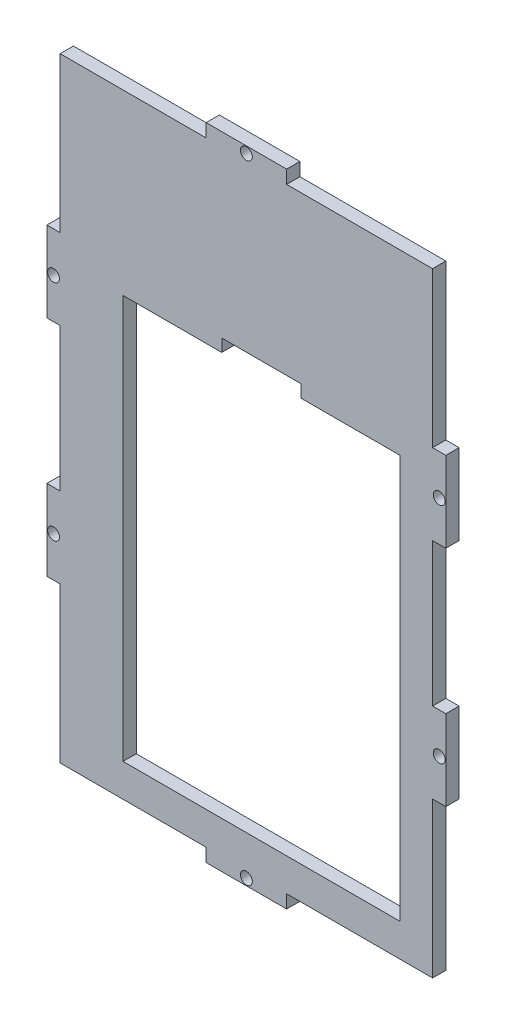
from build123d import *

# Parameters (mm, degrees)
BOSS_EXTRUDE1_DEPTH     = 3.18
CUT_EXTRUDE1_DEPTH      = 87.179315674
SKETCH27_W              = 3.18
SKETCH27_H              = 19.3
BOSS_EXTRUDE9_DEPTH     = 3.18
SKETCH28_W              = 19.3
SKETCH28_H              = 3.18
BOSS_EXTRUDE10_DEPTH    = 3.18
SKETCH29_R              = 1.425
CUT_EXTRUDE14_DEPTH     = 91.550668965
SKETCH30_R              = 1.425
CUT_EXTRUDE15_DEPTH     = 91.550668965
MIRROR9_COPY_1_SKETCH_W = 3.18
MIRROR9_COPY_1_SKETCH_H = 19.3
MIRROR9_COPY_1_DEPTH    = 3.18
MIRROR9_COPY_2_SKETCH_R = 1.425
MIRROR9_COPY_2_DEPTH    = 91.550668965
MIRROR9_COPY_3_SKETCH_W = 3.18
MIRROR9_COPY_3_SKETCH_H = 19.3
MIRROR9_COPY_3_DEPTH    = 3.18
MIRROR9_COPY_4_SKETCH_R = 1.425
MIRROR9_COPY_4_DEPTH    = 91.550668965


with BuildPart() as part:
    # Sketch1 → Boss-Extrude1 (new body)
    with BuildSketch(Plane.XY):
        Polygon((-44.645, 73.645), (-14.881666667, 73.645), (14.881666667, 73.645), (44.645, 73.645), (44.645, -73.645), (-44.645, -73.645), align=None)
    extrude(amount=BOSS_EXTRUDE1_DEPTH)

    # Sketch3 → Cut-Extrude1 (cut, through all)
    with BuildSketch(Plane(origin=(0, 0, 0), x_dir=(-1, 0, 0), z_dir=(0, 0, -1))):
        Polygon((-13.10174207, 30.97325793), (-36.77674207, 30.97325793), (-36.77674207, -65.77674207), (29.57325793, -65.77674207), (29.57325793, 30.97325793), (5.89825793, 30.97325793), (5.89825793, 33.97325793), (-13.10174207, 33.97325793), align=None)
    extrude(amount=-CUT_EXTRUDE1_DEPTH, mode=Mode.SUBTRACT)

    # Sketch27 → Boss-Extrude9 (add)
    with BuildSketch(Plane.ZY.offset(44.645)):
        with Locations((1.59, -26.825)):
            Rectangle(SKETCH27_W, SKETCH27_H)
    boss_extrude9 = extrude(amount=BOSS_EXTRUDE9_DEPTH)

    # Sketch28 → Boss-Extrude10 (add)
    with BuildSketch(Plane.XZ.offset(73.645)):
        with Locations((0, 1.59)):
            Rectangle(SKETCH28_W, SKETCH28_H)
    boss_extrude10 = extrude(amount=BOSS_EXTRUDE10_DEPTH)

    # Sketch29 → Cut-Extrude14 (cut, through all)
    with BuildSketch(Plane.XY.offset(3.18)):
        with Locations((-46.235, -26.825)):
            Circle(SKETCH29_R)
    cut_extrude14 = extrude(amount=-CUT_EXTRUDE14_DEPTH, mode=Mode.SUBTRACT)

    # Sketch30 → Cut-Extrude15 (cut, through all)
    with BuildSketch(Plane.XY.offset(3.18)):
        with Locations((0, -75.235)):
            Circle(SKETCH30_R)
    cut_extrude15 = extrude(amount=-CUT_EXTRUDE15_DEPTH, mode=Mode.SUBTRACT)

    # Mirror8: Boss-Extrude9, Cut-Extrude14 across plane
    add(boss_extrude9.mirror(Plane(origin=(0, 0, 0), x_dir=(0, 0, 1), z_dir=(1, 0, 0))))
    add(cut_extrude14.mirror(Plane(origin=(0, 0, 0), x_dir=(0, 0, 1), z_dir=(1, 0, 0))), mode=Mode.SUBTRACT)

    # Mirror9: Boss-Extrude10, Cut-Extrude15 across plane
    add(boss_extrude10.mirror(Plane.ZX))
    add(cut_extrude15.mirror(Plane.ZX), mode=Mode.SUBTRACT)

    # Mirror9 copy 1 sketch → Mirror9 copy 1 (add)
    with BuildSketch(Plane(origin=(44.645, 0, 0), x_dir=(0, 0, 1), z_dir=(1, 0, 0))):
        with Locations((1.59, -26.825)):
            Rectangle(MIRROR9_COPY_1_SKETCH_W, MIRROR9_COPY_1_SKETCH_H)
    extrude(amount=MIRROR9_COPY_1_DEPTH)

    # Mirror9 copy 2 sketch → Mirror9 copy 2 (cut, through all)
    with BuildSketch(Plane(origin=(0, 0, 3.18), x_dir=(-1, 0, 0), z_dir=(0, 0, 1))):
        with Locations((-46.235, -26.825)):
            Circle(MIRROR9_COPY_2_SKETCH_R)
    extrude(amount=-MIRROR9_COPY_2_DEPTH, mode=Mode.SUBTRACT)

    # Mirror9 copy 3 sketch → Mirror9 copy 3 (add)
    with BuildSketch(Plane.ZY.offset(44.645)):
        with Locations((1.59, 26.825)):
            Rectangle(MIRROR9_COPY_3_SKETCH_W, MIRROR9_COPY_3_SKETCH_H)
    extrude(amount=MIRROR9_COPY_3_DEPTH)

    # Mirror9 copy 4 sketch → Mirror9 copy 4 (cut, through all)
    with BuildSketch(Plane.XY.offset(3.18)):
        with Locations((-46.235, 26.825)):
            Circle(MIRROR9_COPY_4_SKETCH_R)
    extrude(amount=-MIRROR9_COPY_4_DEPTH, mode=Mode.SUBTRACT)


solid = part.part
